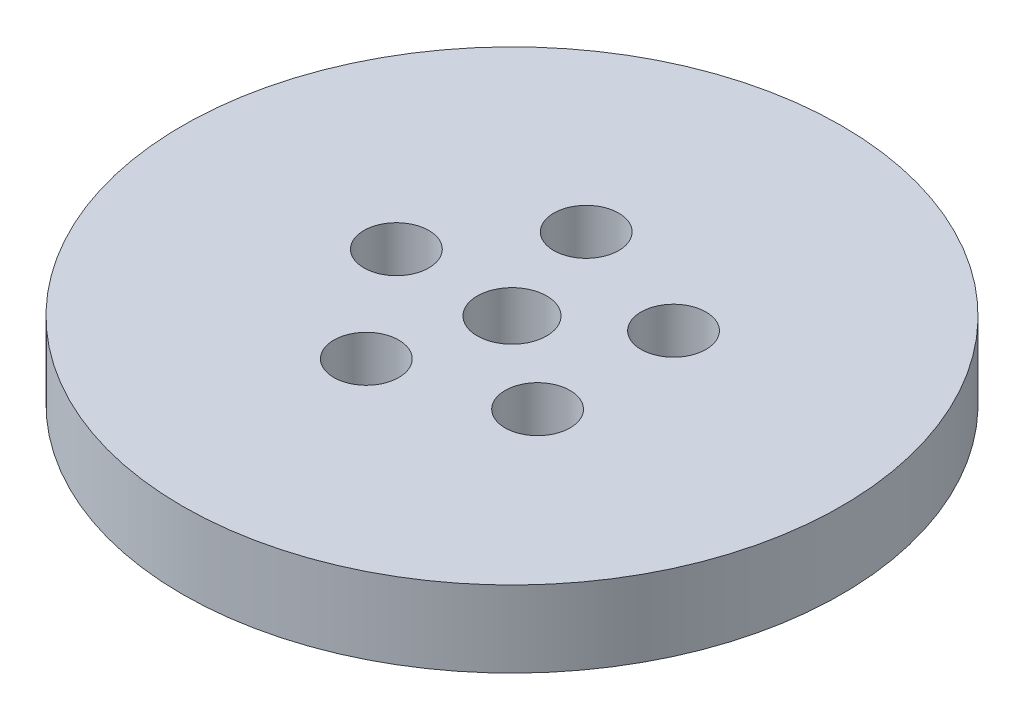
from build123d import *

# Parameters (mm, degrees)
SKETCH1_R           = 95
BOSS_EXTRUDE1_DEPTH = 22
SKETCH2_R           = 10
CUT_EXTRUDE1_DEPTH  = 137.1396342
SKETCH3_R           = 9.364741657
CUT_EXTRUDE2_DEPTH  = 16.157884927
CIRPATTERN1_COUNT   = 5


with BuildPart() as part:
    # Sketch1 → Boss-Extrude1 (new body)
    with BuildSketch(Plane(origin=(0, 0, 0), x_dir=(1, 0, 0), z_dir=(0, 1, 0))):
        Circle(SKETCH1_R)
    extrude(amount=BOSS_EXTRUDE1_DEPTH)

    # Sketch2 → Cut-Extrude1 (cut, through all)
    with BuildSketch(Plane(origin=(0, 0, 0), x_dir=(1, 0, 0), z_dir=(0, 1, 0))):
        Circle(SKETCH2_R)
    extrude(amount=CUT_EXTRUDE1_DEPTH, mode=Mode.SUBTRACT)

    # Sketch3 → Cut-Extrude2 (cut)
    with BuildSketch(Plane(origin=(0, 22, 0), x_dir=(1, 0, 0), z_dir=(0, 1, 0))):
        with Locations((-33.328157692, 0)):
            Circle(SKETCH3_R)
    cut_extrude2 = extrude(amount=-CUT_EXTRUDE2_DEPTH, mode=Mode.SUBTRACT)

    # CirPattern1: Cut-Extrude2 ×5 about axis
    cirpattern1_axis = Axis((0, 0, 0), (0, 1, 0))
    for i in range(1, CIRPATTERN1_COUNT):
        add(cut_extrude2.rotate(cirpattern1_axis, i * 360 / CIRPATTERN1_COUNT), mode=Mode.SUBTRACT)


solid = part.part
